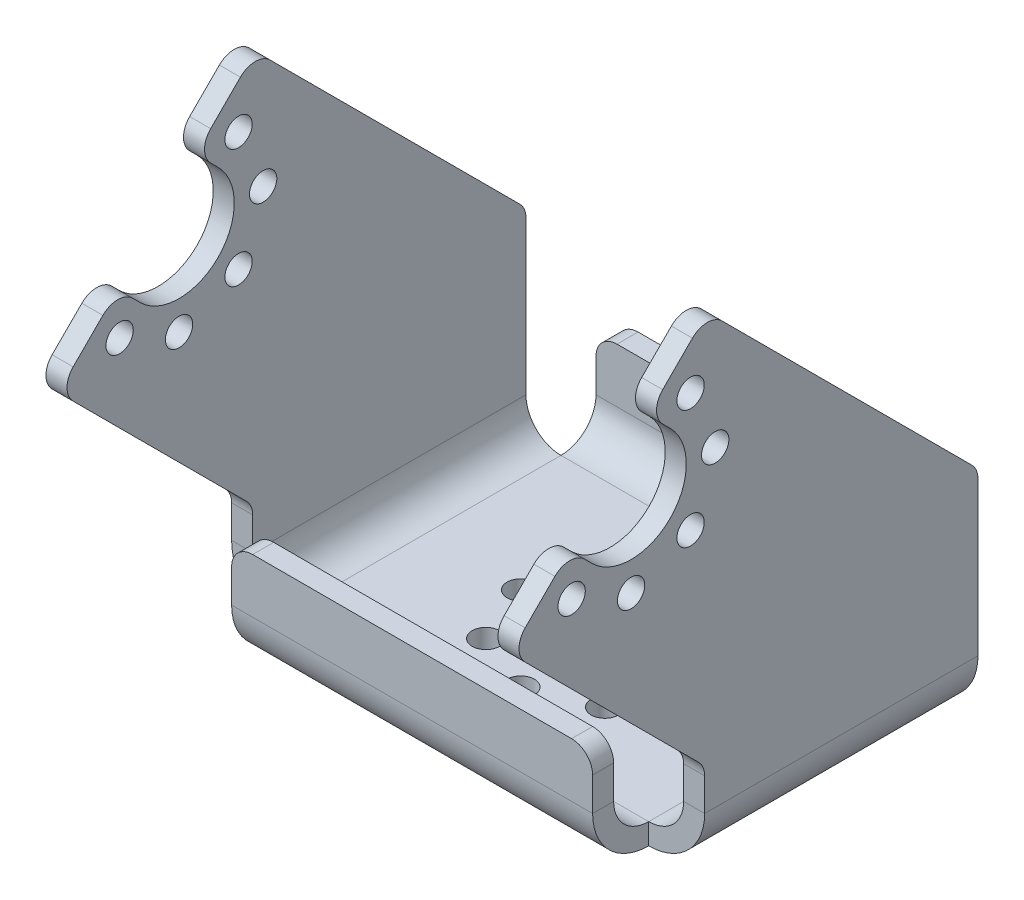
from build123d import *

# Parameters (mm, degrees)
BASE_FLANGE1_DEPTH      = 45
SKETCH5_R               = 4.5
SKETCH5_R_2             = 1.3
CUT_EXTRUDE1_DEPTH      = 10
CUT_EXTRUDE5_DEPTH      = 68.5
CUT_EXTRUDE5_DEPTH_BACK = 68.5
CUT_EXTRUDE6_DEPTH      = 67.821078603
CUT_EXTRUDE6_DEPTH_BACK = 67.821078603
SKETCH9_R               = 1.3
FILLET1_R               = 2
EDGE_FLANGE2_DEPTH      = 34.34
EDGE_FLANGE3_DEPTH      = 34.34
FILLET2_R               = 2


# Sheet-metal steps are written as plain solids
with BuildPart() as part:
    # Sketch1 → Base-Flange1 (new body)
    with BuildSketch(Plane.XY):
        with BuildLine():
            Line((-20.5, 45), (-20.5, 3.33))
            ThreePointArc((-20.5, 3.33), (-19.524665581, 0.975334419), (-17.17, 0))
            Line((-17.17, 0), (17.17, 0))
            ThreePointArc((17.17, 0), (19.524665581, 0.975334419), (20.5, 3.33))
            Line((20.5, 3.33), (20.5, 45))
            Line((20.5, 45), (22.5, 45))
            Line((22.5, 45), (22.5, 3.33))
            ThreePointArc((22.5, 3.33), (20.938879144, -0.438879144), (17.17, -2))
            Line((17.17, -2), (-17.17, -2))
            ThreePointArc((-17.17, -2), (-20.938879144, -0.438879144), (-22.5, 3.33))
            Line((-22.5, 3.33), (-22.5, 45))
            Line((-22.5, 45), (-20.5, 45))
        make_face()
    extrude(amount=BASE_FLANGE1_DEPTH)

    # Sketch5 → Cut-Extrude1 (cut)
    with BuildSketch(Plane(origin=(0, 0, 0), x_dir=(-1, 0, 0), z_dir=(0, 1, 0))):
        with Locations(Location((0, 13, 0), (0, 0, 90))):
            Circle(SKETCH5_R)
        with Locations(Location((0, 5, 0), (0, 0, 90))):
            Circle(SKETCH5_R_2)
        with Locations(Location((-5.656854249, 7.343145751, 0), (0, 0, 90))):
            Circle(SKETCH5_R_2)
        with Locations(Location((-8, 13, 0), (0, 0, 90))):
            Circle(SKETCH5_R_2)
        with Locations(Location((-5.656854249, 18.656854249, 0), (0, 0, 90))):
            Circle(SKETCH5_R_2)
        with Locations(Location((0, 21, 0), (0, 0, 90))):
            Circle(SKETCH5_R_2)
        with Locations(Location((5.656854249, 18.656854249, 0), (0, 0, 90))):
            Circle(SKETCH5_R_2)
        with Locations(Location((8, 13, 0), (0, 0, 90))):
            Circle(SKETCH5_R_2)
        with Locations(Location((5.656854249, 7.343145751, 0), (0, 0, 90))):
            Circle(SKETCH5_R_2)
    extrude(amount=-CUT_EXTRUDE1_DEPTH, mode=Mode.SUBTRACT)

    # Sketch8 → Cut-Extrude5 (cut, two sides: drawn at the far end of the back side and taken through both)
    with BuildSketch(Plane(origin=(0, 0, 0), x_dir=(0, 0, -1), z_dir=(1, 0, 0)).offset(-CUT_EXTRUDE5_DEPTH_BACK)):
        with BuildLine():
            Line((-44.490485194, 25.752155493), (-38.833630945, 31.409009742))
            Line((-38.833630945, 31.409009742), (-36.712310601, 29.287689399))
            ThreePointArc((-36.712310601, 29.287689399), (-29.287689399, 29.287689399), (-29.287689399, 36.712310601))
            Line((-29.287689399, 36.712310601), (-31.409009742, 38.833630945))
            Line((-31.409009742, 38.833630945), (-25.752155493, 44.490485194))
            Line((-25.752155493, 44.490485194), (0, 18.738329701))
            Line((0, 18.738329701), (0, 54.044936655))
            Line((0, 54.044936655), (-47.344215892, 54.044936655))
            Line((-47.344215892, 54.044936655), (-47.344215892, -7.96210432))
            Line((-47.344215892, -7.96210432), (-26, -7.96210432))
            Line((-26, -7.96210432), (-26, 7.261670299))
            Line((-26, 7.261670299), (-44.490485194, 25.752155493))
        make_face()
    extrude(amount=CUT_EXTRUDE5_DEPTH + CUT_EXTRUDE5_DEPTH_BACK, mode=Mode.SUBTRACT)

    # Sketch9 → Cut-Extrude6 (cut, two sides: drawn at the far end of the back side and taken through both)
    with BuildSketch(Plane(origin=(0, 0, 0), x_dir=(0, 0, -1), z_dir=(1, 0, 0)).offset(-CUT_EXTRUDE6_DEPTH_BACK)):
        with Locations((-38.656854249, 27.343145751)):
            Circle(SKETCH9_R)
        with Locations((-41, 33)):
            Circle(SKETCH9_R)
        with Locations((-38.656854249, 38.656854249)):
            Circle(SKETCH9_R)
        with Locations((-33, 41)):
            Circle(SKETCH9_R)
        with Locations((-27.343145751, 38.656854249)):
            Circle(SKETCH9_R)
        with Locations((-25, 33)):
            Circle(SKETCH9_R)
        with Locations((-27.343145751, 27.343145751)):
            Circle(SKETCH9_R)
        with Locations((-33, 25)):
            Circle(SKETCH9_R)
    extrude(amount=CUT_EXTRUDE6_DEPTH + CUT_EXTRUDE6_DEPTH_BACK, mode=Mode.SUBTRACT)

    # Fillet1
    fillet1_edges = [part.edges().sort_by_distance(p)[0] for p in [
        (21.5, 18.738329701, 0),
        (21.5, 44.490485194, 25.752155493),
        (21.5, 38.833630945, 31.409009742),
        (21.5, 31.409009742, 38.833630945),
        (21.5, 25.752155493, 44.490485194),
        (21.5, 7.261670299, 26),
        (-21.5, 18.738329701, 0),
        (-21.5, 44.490485194, 25.752155493),
        (-21.5, 38.833630945, 31.409009742),
        (-21.5, 31.409009742, 38.833630945),
        (-21.5, 25.752155493, 44.490485194),
        (-21.5, 7.261670299, 26),
    ]]
    fillet(fillet1_edges, radius=FILLET1_R)

    # Edge-Flange2 section (across the edge) → Edge-Flange2 (add)
    with BuildSketch(Plane(origin=(-17.17, 0, 29.33), x_dir=(0, 0, -1), z_dir=(1, 0, 0))):
        with BuildLine():
            Line((-2, 3.33), (-2, 8.5))
            Line((-2, 8.5), (0, 8.5))
            Line((0, 8.5), (0, 3.33))
            ThreePointArc((0, 3.33), (0.975334419, 0.975334419), (3.33, 0))
            Line((3.33, 0), (3.33, -2))
            ThreePointArc((3.33, -2), (-0.438879144, -0.438879144), (-2, 3.33))
        make_face()
    extrude(amount=EDGE_FLANGE2_DEPTH)

    # Edge-Flange3 section (across the edge) → Edge-Flange3 (add)
    with BuildSketch(Plane(origin=(17.17, 0, -3.33), x_dir=(0, 0, 1), z_dir=(-1, 0, 0))):
        with BuildLine():
            Line((-2, 3.33), (-2, 8.5))
            Line((-2, 8.5), (0, 8.5))
            Line((0, 8.5), (0, 3.33))
            ThreePointArc((0, 3.33), (0.975334419, 0.975334419), (3.33, 0))
            Line((3.33, 0), (3.33, -2))
            ThreePointArc((3.33, -2), (-0.438879144, -0.438879144), (-2, 3.33))
        make_face()
    extrude(amount=EDGE_FLANGE3_DEPTH)

    # Fillet2
    fillet2_edges = [part.edges().sort_by_distance(p)[0] for p in [
        (-17.17, 8.5, 30.33),
        (17.17, 8.5, 30.33),
        (17.17, 8.5, -4.33),
        (-17.17, 8.5, -4.33),
    ]]
    fillet(fillet2_edges, radius=FILLET2_R)


solid = part.part
